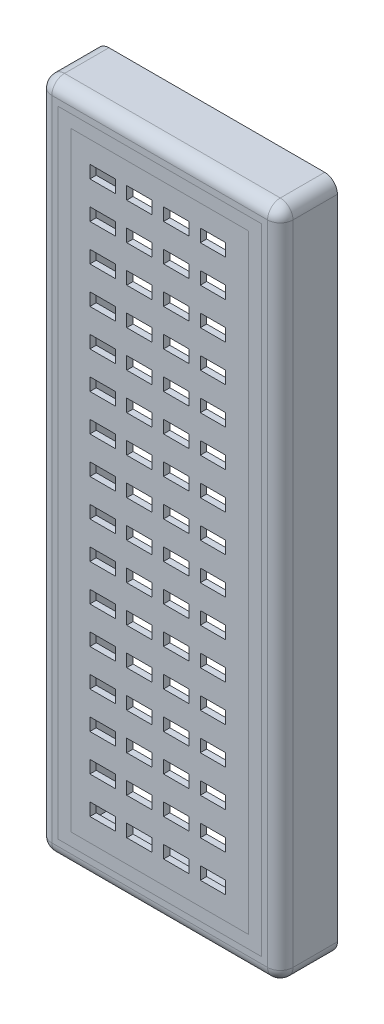
from build123d import *

# Parameters (mm, degrees)
SKETCH1_W            = 241.3
SKETCH1_H            = 673.1
SKETCH1_W_2          = 203.2
SKETCH1_H_2          = 635
BOSS_EXTRUDE1_DEPTH  = 50.8
SKETCH2_W            = 241.3
SKETCH2_H            = 673.1
BOSS_EXTRUDE2_DEPTH  = 6.35
SKETCH5_W            = 25.4
SKETCH5_H            = 12.7
CUT_EXTRUDE2_DEPTH   = 33.02
LPATTERN1_COUNT      = 16
LPATTERN1_PITCH      = 36.83
LPATTERN1_COUNT_DIR2 = 4
LPATTERN1_PITCH_DIR2 = 36.83
FILLET1_R            = 12.7
FILLET2_R            = 12.7


with BuildPart() as part:
    # Sketch1 → Boss-Extrude1 (new body)
    with BuildSketch(Plane.XY):
        with Locations((101.6, -317.5)):
            Rectangle(SKETCH1_W, SKETCH1_H)
        with Locations((101.6, -317.5)):
            Rectangle(SKETCH1_W_2, SKETCH1_H_2, mode=Mode.SUBTRACT)
    extrude(amount=BOSS_EXTRUDE1_DEPTH)

    # Sketch2 → Boss-Extrude2 (add)
    with BuildSketch(Plane.XY.offset(50.8)):
        with Locations((101.6, -317.5)):
            Rectangle(SKETCH2_W, SKETCH2_H)
    extrude(amount=BOSS_EXTRUDE2_DEPTH)

    # Sketch5 → Cut-Extrude2 (cut)
    with BuildSketch(Plane.XY.offset(57.15)):
        with Locations((44.45, -40.64)):
            Rectangle(SKETCH5_W, SKETCH5_H)
    cut_extrude2 = extrude(amount=-CUT_EXTRUDE2_DEPTH, mode=Mode.SUBTRACT)

    # LPattern1: Cut-Extrude2 16 × 4
    with Locations(*[(j * LPATTERN1_PITCH_DIR2, -i * LPATTERN1_PITCH, 0) for i in range(LPATTERN1_COUNT) for j in range(LPATTERN1_COUNT_DIR2) if (i, j) != (0, 0)]):
        add(cut_extrude2, mode=Mode.SUBTRACT)

    # Fillet1
    fillet1_edges = [part.edges().sort_by_distance(p)[0] for p in [
        (-19.05, -317.5, 57.15),
        (101.6, -654.05, 57.15),
        (222.25, -317.5, 57.15),
        (101.6, 19.05, 57.15),
    ]]
    fillet(fillet1_edges, radius=FILLET1_R)

    # Fillet2
    # the kernel refuses this fillet: 12.7 mm, written as the material it takes off along each edge
    with BuildSketch(Plane(origin=(-6.35, -641.35, 44.45), x_dir=(0, -1, 0), z_dir=(-1, 0, 0))) as fillet2_piece_1_section:
        Polygon((0, 0), (FILLET2_R * 1.02, 0), (FILLET2_R * 1.02, FILLET2_R * 1.02), (0, FILLET2_R * 1.02), align=None)
    fillet2_piece_1 = extrude(amount=FILLET2_R * 1.02, mode=Mode.PRIVATE)
    fillet2_piece_1 = fillet2_piece_1 - Plane(origin=(-6.35, -641.35, 44.45), x_dir=(0, 0.7071067811865475, -0.7071067811865475), z_dir=(-1, 0, 0)) * Sphere(FILLET2_R, mode=Mode.PRIVATE)
    add(fillet2_piece_1, mode=Mode.SUBTRACT)
    with BuildSketch(Plane(origin=(-6.35, 6.35, 44.45), x_dir=(-1, 0, 0), z_dir=(0, 1, 0))) as fillet2_piece_2_section:
        Polygon((0, 0), (FILLET2_R * 1.02, 0), (FILLET2_R * 1.02, FILLET2_R * 1.02), (0, FILLET2_R * 1.02), align=None)
    fillet2_piece_2 = extrude(amount=FILLET2_R * 1.02, mode=Mode.PRIVATE)
    fillet2_piece_2 = fillet2_piece_2 - Plane(origin=(-6.35, 6.35, 44.45), x_dir=(0.7071067811865475, 0, -0.7071067811865475), z_dir=(0, 1, 0)) * Sphere(FILLET2_R, mode=Mode.PRIVATE)
    add(fillet2_piece_2, mode=Mode.SUBTRACT)
    with BuildSketch(Plane(origin=(209.55, -641.35, 44.45), x_dir=(0, -1, 0), z_dir=(1, 0, 0))) as fillet2_piece_3_section:
        Polygon((0, 0), (FILLET2_R * 1.02, 0), (FILLET2_R * 1.02, -FILLET2_R * 1.02), (0, -FILLET2_R * 1.02), align=None)
    fillet2_piece_3 = extrude(amount=FILLET2_R * 1.02, mode=Mode.PRIVATE)
    fillet2_piece_3 = fillet2_piece_3 - Plane(origin=(209.55, -641.35, 44.45), x_dir=(0, 0.7071067811865475, -0.7071067811865475), z_dir=(1, 0, 0)) * Sphere(FILLET2_R, mode=Mode.PRIVATE)
    add(fillet2_piece_3, mode=Mode.SUBTRACT)
    with BuildSketch(Plane(origin=(209.55, 6.35, 44.45), x_dir=(1, 0, 0), z_dir=(0, 1, 0))) as fillet2_piece_4_section:
        Polygon((0, 0), (FILLET2_R * 1.02, 0), (FILLET2_R * 1.02, -FILLET2_R * 1.02), (0, -FILLET2_R * 1.02), align=None)
    fillet2_piece_4 = extrude(amount=FILLET2_R * 1.02, mode=Mode.PRIVATE)
    fillet2_piece_4 = fillet2_piece_4 - Plane(origin=(209.55, 6.35, 44.45), x_dir=(-0.7071067811865475, 0, -0.7071067811865475), z_dir=(0, 1, 0)) * Sphere(FILLET2_R, mode=Mode.PRIVATE)
    add(fillet2_piece_4, mode=Mode.SUBTRACT)
    with BuildSketch(Plane(origin=(222.25, 19.05, 44.45), x_dir=(-1, 0, 0), z_dir=(0, 0, -1)), Plane(origin=(222.25, -654.05, 44.45), x_dir=(0, 1, 0), z_dir=(0, 0, -1)), Plane(origin=(-19.05, -654.05, -31.75), x_dir=(0, 1, 0), z_dir=(0, 0, 1)), Plane(origin=(-19.05, 19.05, -31.75), x_dir=(1, 0, 0), z_dir=(0, 0, 1))) as fillet2_piece_5:
        with BuildLine():
            CenterArc((FILLET2_R, -FILLET2_R), FILLET2_R, 90, 90)
            Line((0, -FILLET2_R), (0, 0))
            Line((0, 0), (FILLET2_R, 0))
        make_face()
    extrude(amount=76.2, mode=Mode.SUBTRACT)


solid = part.part
